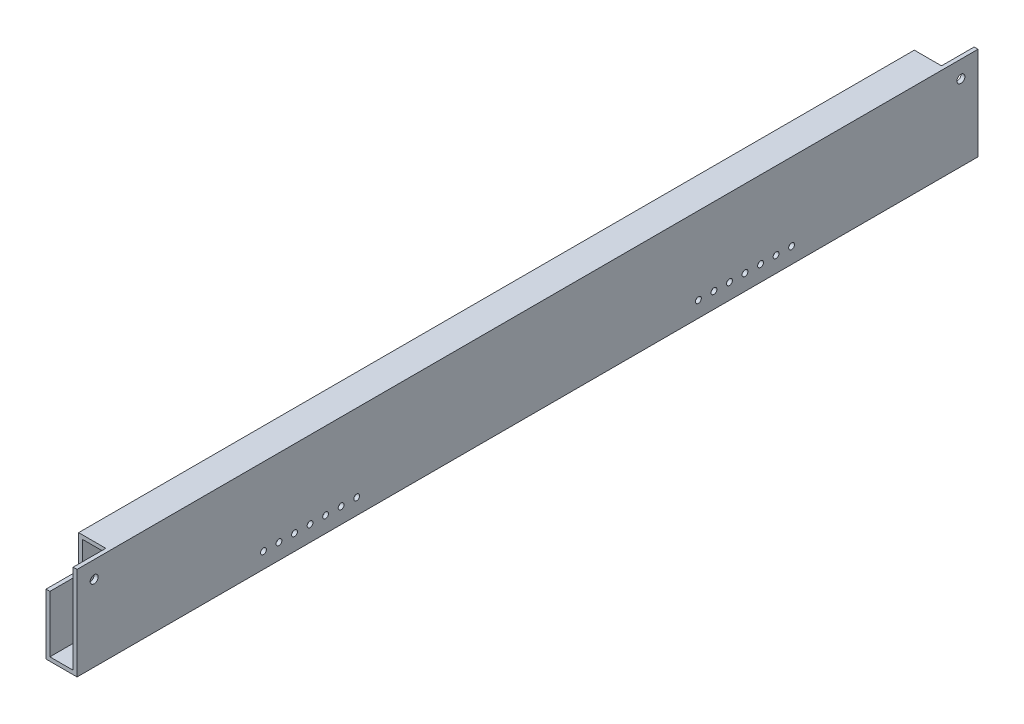
from build123d import *

# Parameters (mm, degrees)
SKETCH1_W           = 25.4
SKETCH1_H           = 76.2
BOSS_EXTRUDE1_DEPTH = 368.3
SHELL1_T            = -3.175
CUT_EXTRUDE2_REACH  = 373.136
SKETCH3_R           = 2.38125
SKETCH4_W           = 26.67
SKETCH4_H           = 26.67
CUT_EXTRUDE3_DEPTH  = 22.225
SKETCH5_R           = 3.25
CUT_EXTRUDE4_DEPTH  = 22.225


with BuildPart() as part:
    # Sketch1 → Boss-Extrude1 (new, symmetric)
    with BuildSketch(Plane.XY):
        Rectangle(SKETCH1_W, SKETCH1_H)
    extrude(amount=BOSS_EXTRUDE1_DEPTH, both=True)

    # Shell1
    shell1_openings = [part.faces().sort_by_distance(p)[0] for p in [
        (0, 0, -368.3),
        (0, 0, 368.3),
    ]]
    offset(amount=SHELL1_T, openings=shell1_openings, kind=Kind.INTERSECTION)

    # Sketch3 → Cut-Extrude2 (cut, up to next)
    with BuildSketch(Plane(origin=(12.7, 0, 0), x_dir=(0, 0, -1), z_dir=(1, 0, 0)), mode=Mode.PRIVATE) as cut_extrude2_sk1:
        with Locations((215.9, -25.195900078)):
            Circle(SKETCH3_R)
    cut_extrude2_tool1 = extrude(cut_extrude2_sk1.sketch, amount=-CUT_EXTRUDE2_REACH, mode=Mode.PRIVATE) & part.part
    # Sketch3 → Cut-Extrude2 (cut, up to next)
    with BuildSketch(Plane(origin=(12.7, 0, 0), x_dir=(0, 0, -1), z_dir=(1, 0, 0)), mode=Mode.PRIVATE) as cut_extrude2_sk2:
        with Locations((203.2, -25.195900078)):
            Circle(SKETCH3_R)
    cut_extrude2_tool2 = extrude(cut_extrude2_sk2.sketch, amount=-CUT_EXTRUDE2_REACH, mode=Mode.PRIVATE) & part.part
    # Sketch3 → Cut-Extrude2 (cut, up to next)
    with BuildSketch(Plane(origin=(12.7, 0, 0), x_dir=(0, 0, -1), z_dir=(1, 0, 0)), mode=Mode.PRIVATE) as cut_extrude2_sk3:
        with Locations((190.5, -25.195900078)):
            Circle(SKETCH3_R)
    cut_extrude2_tool3 = extrude(cut_extrude2_sk3.sketch, amount=-CUT_EXTRUDE2_REACH, mode=Mode.PRIVATE) & part.part
    # Sketch3 → Cut-Extrude2 (cut, up to next)
    with BuildSketch(Plane(origin=(12.7, 0, 0), x_dir=(0, 0, -1), z_dir=(1, 0, 0)), mode=Mode.PRIVATE) as cut_extrude2_sk4:
        with Locations((177.8, -25.195900078)):
            Circle(SKETCH3_R)
    cut_extrude2_tool4 = extrude(cut_extrude2_sk4.sketch, amount=-CUT_EXTRUDE2_REACH, mode=Mode.PRIVATE) & part.part
    # Sketch3 → Cut-Extrude2 (cut, up to next)
    with BuildSketch(Plane(origin=(12.7, 0, 0), x_dir=(0, 0, -1), z_dir=(1, 0, 0)), mode=Mode.PRIVATE) as cut_extrude2_sk5:
        with Locations((165.1, -25.195900078)):
            Circle(SKETCH3_R)
    cut_extrude2_tool5 = extrude(cut_extrude2_sk5.sketch, amount=-CUT_EXTRUDE2_REACH, mode=Mode.PRIVATE) & part.part
    # Sketch3 → Cut-Extrude2 (cut, up to next)
    with BuildSketch(Plane(origin=(12.7, 0, 0), x_dir=(0, 0, -1), z_dir=(1, 0, 0)), mode=Mode.PRIVATE) as cut_extrude2_sk6:
        with Locations((152.4, -25.195900078)):
            Circle(SKETCH3_R)
    cut_extrude2_tool6 = extrude(cut_extrude2_sk6.sketch, amount=-CUT_EXTRUDE2_REACH, mode=Mode.PRIVATE) & part.part
    # Sketch3 → Cut-Extrude2 (cut, up to next)
    with BuildSketch(Plane(origin=(12.7, 0, 0), x_dir=(0, 0, -1), z_dir=(1, 0, 0)), mode=Mode.PRIVATE) as cut_extrude2_sk7:
        with Locations((139.7, -25.195900078)):
            Circle(SKETCH3_R)
    cut_extrude2_tool7 = extrude(cut_extrude2_sk7.sketch, amount=-CUT_EXTRUDE2_REACH, mode=Mode.PRIVATE) & part.part
    # Sketch3 → Cut-Extrude2 (cut, up to next)
    with BuildSketch(Plane(origin=(12.7, 0, 0), x_dir=(0, 0, -1), z_dir=(1, 0, 0)), mode=Mode.PRIVATE) as cut_extrude2_sk8:
        with Locations((-139.7, -25.195900078)):
            Circle(SKETCH3_R)
    cut_extrude2_tool8 = extrude(cut_extrude2_sk8.sketch, amount=-CUT_EXTRUDE2_REACH, mode=Mode.PRIVATE) & part.part
    # Sketch3 → Cut-Extrude2 (cut, up to next)
    with BuildSketch(Plane(origin=(12.7, 0, 0), x_dir=(0, 0, -1), z_dir=(1, 0, 0)), mode=Mode.PRIVATE) as cut_extrude2_sk9:
        with Locations((-152.4, -25.195900078)):
            Circle(SKETCH3_R)
    cut_extrude2_tool9 = extrude(cut_extrude2_sk9.sketch, amount=-CUT_EXTRUDE2_REACH, mode=Mode.PRIVATE) & part.part
    # Sketch3 → Cut-Extrude2 (cut, up to next)
    with BuildSketch(Plane(origin=(12.7, 0, 0), x_dir=(0, 0, -1), z_dir=(1, 0, 0)), mode=Mode.PRIVATE) as cut_extrude2_sk10:
        with Locations((-165.1, -25.195900078)):
            Circle(SKETCH3_R)
    cut_extrude2_tool10 = extrude(cut_extrude2_sk10.sketch, amount=-CUT_EXTRUDE2_REACH, mode=Mode.PRIVATE) & part.part
    # Sketch3 → Cut-Extrude2 (cut, up to next)
    with BuildSketch(Plane(origin=(12.7, 0, 0), x_dir=(0, 0, -1), z_dir=(1, 0, 0)), mode=Mode.PRIVATE) as cut_extrude2_sk11:
        with Locations((-203.2, -25.195900078)):
            Circle(SKETCH3_R)
    cut_extrude2_tool11 = extrude(cut_extrude2_sk11.sketch, amount=-CUT_EXTRUDE2_REACH, mode=Mode.PRIVATE) & part.part
    # Sketch3 → Cut-Extrude2 (cut, up to next)
    with BuildSketch(Plane(origin=(12.7, 0, 0), x_dir=(0, 0, -1), z_dir=(1, 0, 0)), mode=Mode.PRIVATE) as cut_extrude2_sk12:
        with Locations((-177.8, -25.195900078)):
            Circle(SKETCH3_R)
    cut_extrude2_tool12 = extrude(cut_extrude2_sk12.sketch, amount=-CUT_EXTRUDE2_REACH, mode=Mode.PRIVATE) & part.part
    # Sketch3 → Cut-Extrude2 (cut, up to next)
    with BuildSketch(Plane(origin=(12.7, 0, 0), x_dir=(0, 0, -1), z_dir=(1, 0, 0)), mode=Mode.PRIVATE) as cut_extrude2_sk13:
        with Locations((-215.9, -25.195900078)):
            Circle(SKETCH3_R)
    cut_extrude2_tool13 = extrude(cut_extrude2_sk13.sketch, amount=-CUT_EXTRUDE2_REACH, mode=Mode.PRIVATE) & part.part
    # Sketch3 → Cut-Extrude2 (cut, up to next)
    with BuildSketch(Plane(origin=(12.7, 0, 0), x_dir=(0, 0, -1), z_dir=(1, 0, 0)), mode=Mode.PRIVATE) as cut_extrude2_sk14:
        with Locations((-190.5, -25.195900078)):
            Circle(SKETCH3_R)
    cut_extrude2_tool14 = extrude(cut_extrude2_sk14.sketch, amount=-CUT_EXTRUDE2_REACH, mode=Mode.PRIVATE) & part.part
    add(cut_extrude2_tool1.solids().sort_by_distance((12.7, -25.1959, -215.9))[0], mode=Mode.SUBTRACT)
    add(cut_extrude2_tool2.solids().sort_by_distance((12.7, -25.1959, -203.2))[0], mode=Mode.SUBTRACT)
    add(cut_extrude2_tool3.solids().sort_by_distance((12.7, -25.1959, -190.5))[0], mode=Mode.SUBTRACT)
    add(cut_extrude2_tool4.solids().sort_by_distance((12.7, -25.1959, -177.8))[0], mode=Mode.SUBTRACT)
    add(cut_extrude2_tool5.solids().sort_by_distance((12.7, -25.1959, -165.1))[0], mode=Mode.SUBTRACT)
    add(cut_extrude2_tool6.solids().sort_by_distance((12.7, -25.1959, -152.4))[0], mode=Mode.SUBTRACT)
    add(cut_extrude2_tool7.solids().sort_by_distance((12.7, -25.1959, -139.7))[0], mode=Mode.SUBTRACT)
    add(cut_extrude2_tool8.solids().sort_by_distance((12.7, -25.1959, 139.7))[0], mode=Mode.SUBTRACT)
    add(cut_extrude2_tool9.solids().sort_by_distance((12.7, -25.1959, 152.4))[0], mode=Mode.SUBTRACT)
    add(cut_extrude2_tool10.solids().sort_by_distance((12.7, -25.1959, 165.1))[0], mode=Mode.SUBTRACT)
    add(cut_extrude2_tool11.solids().sort_by_distance((12.7, -25.1959, 203.2))[0], mode=Mode.SUBTRACT)
    add(cut_extrude2_tool12.solids().sort_by_distance((12.7, -25.1959, 177.8))[0], mode=Mode.SUBTRACT)
    add(cut_extrude2_tool13.solids().sort_by_distance((12.7, -25.1959, 215.9))[0], mode=Mode.SUBTRACT)
    add(cut_extrude2_tool14.solids().sort_by_distance((12.7, -25.1959, 190.5))[0], mode=Mode.SUBTRACT)

    # Sketch4 → Cut-Extrude3 (cut)
    with BuildSketch(Plane.ZY.offset(12.7)):
        with Locations((-354.965, 24.765)):
            Rectangle(SKETCH4_W, SKETCH4_H)
        with Locations((354.965, 24.765)):
            Rectangle(SKETCH4_W, SKETCH4_H)
    extrude(amount=-CUT_EXTRUDE3_DEPTH, mode=Mode.SUBTRACT)

    # Sketch5 → Cut-Extrude4 (cut)
    with BuildSketch(Plane.ZY.offset(-9.525)):
        with Locations((-354.33, 24.13)):
            Circle(SKETCH5_R)
        with Locations((354.33, 24.13)):
            Circle(SKETCH5_R)
    extrude(amount=-CUT_EXTRUDE4_DEPTH, mode=Mode.SUBTRACT)


solid = part.part
